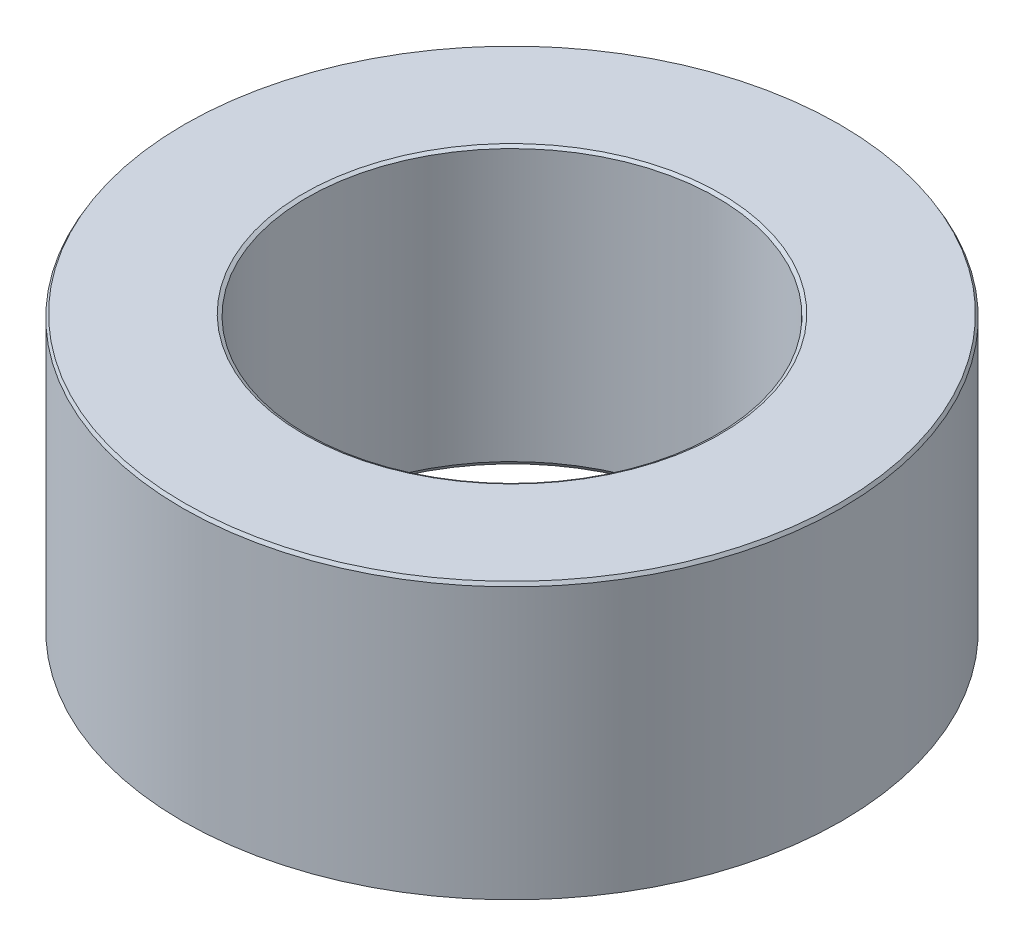
from build123d import *
from OCP.BRepFilletAPI import BRepFilletAPI_MakeChamfer

# Parameters (mm, degrees)
SKETCH1_R           = 37.5
BOSS_EXTRUDE1_DEPTH = 31.439649156
SKETCH2_R           = 23.324281946
CUT_EXTRUDE1_DEPTH  = 62.651857547
CHAMFER1_SIZE       = 0.385641947
CHAMFER1_SIZE2      = 0.222650482


with BuildPart() as part:
    # Sketch1 → Boss-Extrude1 (new body)
    with BuildSketch(Plane(origin=(0, 0, 0), x_dir=(1, 0, 0), z_dir=(0, 1, 0))):
        Circle(SKETCH1_R)
    extrude(amount=BOSS_EXTRUDE1_DEPTH)

    # Sketch2 → Cut-Extrude1 (cut, through all)
    with BuildSketch(Plane(origin=(0, 0, 0), x_dir=(1, 0, 0), z_dir=(0, 1, 0))):
        Circle(SKETCH2_R)
    extrude(amount=CUT_EXTRUDE1_DEPTH, mode=Mode.SUBTRACT)

    # Chamfer1: one chamfer whose edges measure the first distance from different faces: ONE call of the kernel's chamfer builder (chamfer() names one face for all edges)
    chamfer1_edges_1 = [part.edges().sort_by_distance(p)[0] for p in [
        (-23.324281946, 31.439649156, 0),
    ]]
    chamfer1_side_1 = [part.faces().sort_by_distance(p)[0] for p in [
        (-36.439339828, 31.439649156, 0),
    ]]
    chamfer1_edges_2 = [part.edges().sort_by_distance(p)[0] for p in [
        (-23.324281946, 0, 0),
    ]]
    chamfer1_side_2 = [part.faces().sort_by_distance(p)[0] for p in [
        (-23.324281946, 15.719824578, 0),
    ]]
    chamfer1_edges_3 = [part.edges().sort_by_distance(p)[0] for p in [
        (-37.5, 0, 0),
    ]]
    chamfer1_side_3 = [part.faces().sort_by_distance(p)[0] for p in [
        (-36.439339828, 0, 0),
    ]]
    chamfer1_edges_4 = [part.edges().sort_by_distance(p)[0] for p in [
        (-37.5, 31.439649156, 0),
    ]]
    chamfer1_side_4 = [part.faces().sort_by_distance(p)[0] for p in [
        (-37.5, 15.719824578, 0),
    ]]
    chamfer1 = BRepFilletAPI_MakeChamfer(part.part.solid().wrapped)
    for e in chamfer1_edges_1:
        chamfer1.Add(CHAMFER1_SIZE, CHAMFER1_SIZE2, e.wrapped, chamfer1_side_1[0].wrapped)  # the first distance lies on this face
    for e in chamfer1_edges_2:
        chamfer1.Add(CHAMFER1_SIZE, CHAMFER1_SIZE2, e.wrapped, chamfer1_side_2[0].wrapped)  # the first distance lies on this face
    for e in chamfer1_edges_3:
        chamfer1.Add(CHAMFER1_SIZE, CHAMFER1_SIZE2, e.wrapped, chamfer1_side_3[0].wrapped)  # the first distance lies on this face
    for e in chamfer1_edges_4:
        chamfer1.Add(CHAMFER1_SIZE, CHAMFER1_SIZE2, e.wrapped, chamfer1_side_4[0].wrapped)  # the first distance lies on this face
    add(Compound.cast(chamfer1.Shape()), mode=Mode.REPLACE)


solid = part.part
